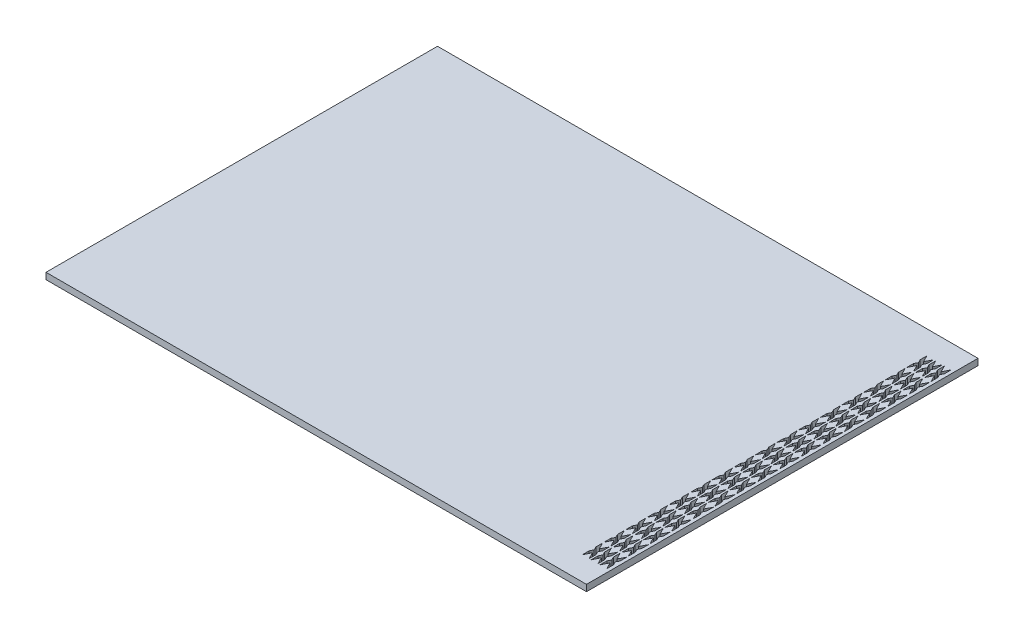
from build123d import *

# Parameters (mm, degrees)
SKETCH1_W            = 203.2
SKETCH1_H            = 147.193
BOSS_EXTRUDE1_DEPTH  = 2.413
CUT_EXTRUDE1_DEPTH   = 2.794
LPATTERN1_COUNT      = 16
LPATTERN1_PITCH      = 8.128
LPATTERN1_COUNT_DIR2 = 3
LPATTERN1_PITCH_DIR2 = 3.302


with BuildPart() as part:
    # Sketch1 → Boss-Extrude1 (new body)
    with BuildSketch(Plane(origin=(0, 0, 0), x_dir=(1, 0, 0), z_dir=(0, 1, 0))):
        with Locations((35.207920792, -46.864886139)):
            Rectangle(SKETCH1_W, SKETCH1_H)
    extrude(amount=BOSS_EXTRUDE1_DEPTH)

    # Sketch2 → Cut-Extrude1 (cut)
    with BuildSketch(Plane(origin=(0, 2.413, 0), x_dir=(0, 0, -1), z_dir=(0, 1, 0))):
        Polygon((-111.571386139, -132.997920792), (-109.051386139, -134.267920792), (-111.571386139, -135.537920792), (-109.031386139, -135.537920792), (-107.781386139, -134.907960475), (-106.531386139, -135.537920792), (-103.991386139, -135.537920792), (-106.511386139, -134.267920792), (-103.991386139, -132.997920792), (-106.531386139, -132.997920792), (-107.781386139, -133.62788111), (-109.031386139, -132.997920792), align=None)
    cut_extrude1 = extrude(amount=-CUT_EXTRUDE1_DEPTH, mode=Mode.SUBTRACT)

    # LPattern1: Cut-Extrude1 16 × 3
    with Locations(*[(-j * LPATTERN1_PITCH_DIR2, 0, -i * LPATTERN1_PITCH) for i in range(LPATTERN1_COUNT) for j in range(LPATTERN1_COUNT_DIR2) if (i, j) != (0, 0)]):
        add(cut_extrude1, mode=Mode.SUBTRACT)


solid = part.part
